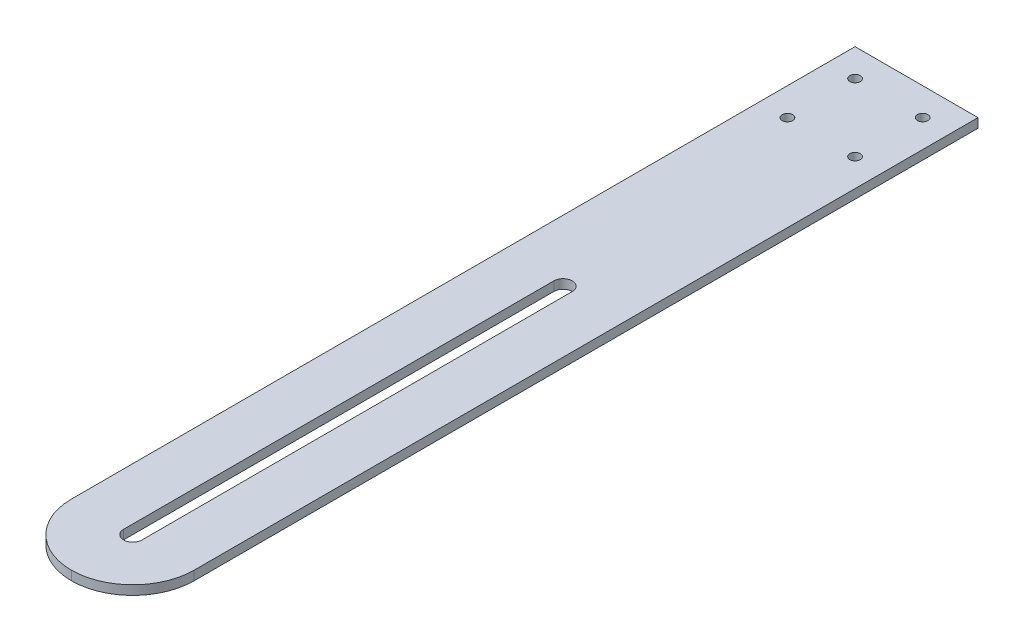
from build123d import *

# Parameters (mm, degrees)
SKETCH1_W           = 40
SKETCH1_H           = 275
BOSS_EXTRUDE1_DEPTH = 3
SKETCH2_R           = 1.7
CUT_EXTRUDE1_DEPTH  = 139.979315008
FILLET1_R           = 20
CUT_EXTRUDE2_DEPTH  = 139.979315008


with BuildPart() as part:
    # Sketch1 → Boss-Extrude1 (new body)
    with BuildSketch(Plane(origin=(0, 0, 0), x_dir=(1, 0, 0), z_dir=(0, 1, 0))):
        Rectangle(SKETCH1_W, SKETCH1_H)
    extrude(amount=BOSS_EXTRUDE1_DEPTH)

    # Sketch2 → Cut-Extrude1 (cut, through all)
    with BuildSketch(Plane(origin=(0, 3, 0), x_dir=(1, 0, 0), z_dir=(0, 1, 0))):
        with Locations(Location((-11, 128.5, 0), (0, 0, 270))):
            Circle(SKETCH2_R)
        with Locations(Location((-11, 106.5, 0), (0, 0, 270))):
            Circle(SKETCH2_R)
        with Locations(Location((11, 128.5, 0), (0, 0, 270))):
            Circle(SKETCH2_R)
        with Locations(Location((11, 106.5, 0), (0, 0, 270))):
            Circle(SKETCH2_R)
    extrude(amount=-CUT_EXTRUDE1_DEPTH, mode=Mode.SUBTRACT)

    # Fillet1
    fillet1_edges = [part.edges().sort_by_distance(p)[0] for p in [
        (-20, 1.5, 137.5),
        (20, 1.5, 137.5),
    ]]
    fillet(fillet1_edges, radius=FILLET1_R - 0.0001)  # a hair under: the kernel refuses the full size

    # Sketch3 → Cut-Extrude2 (cut, through all)
    with BuildSketch(Plane(origin=(0, 3, 0), x_dir=(1, 0, 0), z_dir=(0, 1, 0))):
        with BuildLine():
            Line((-3, 22.5), (-3, -117.5))
            ThreePointArc((-3, -117.5), (0, -120.5), (3, -117.5))
            Line((3, -117.5), (3, 22.5))
            ThreePointArc((3, 22.5), (0, 25.5), (-3, 22.5))
        make_face()
    extrude(amount=-CUT_EXTRUDE2_DEPTH, mode=Mode.SUBTRACT)


solid = part.part
